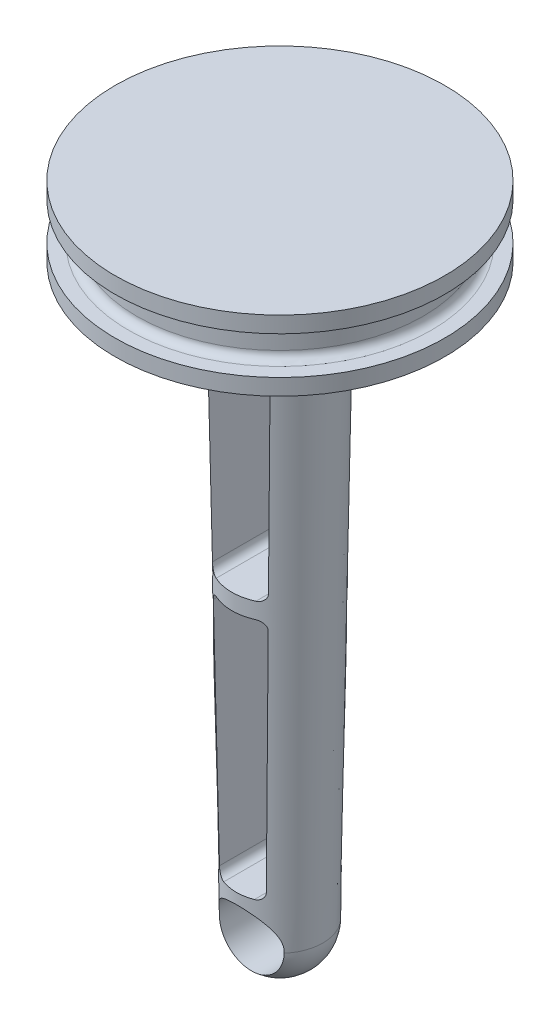
from build123d import *

# Parameters (mm, degrees)
CUT_EXTRUDE1_REACH                  = 68.589
CUT_EXTRUDE1_END_RADIUS             = 5
SKETCH2_R                           = 3
SKETCH2_W                           = 6
SKETCH2_H                           = 22.75
CUT_EXTRUDE1_DIRECTION_2_REACH      = 68.589
CUT_EXTRUDE1_DIRECTION_2_END_RADIUS = 5
CUT_EXTRUDE2_REACH                  = 70.089
CUT_EXTRUDE2_START                  = 1.5
SKETCH3_R                           = 12
SKETCH3_R_2                         = 5
DRAFT5_ANGLE                        = -1
FILLET3_R                           = 0.75
FILLET5_R                           = 3.964
FILLET6_R                           = 2.25


# Read off the part's stored shape, not the designer's step: Draft4
with BuildPart() as part:
    # Sketch1 → Revolve4 (revolve)
    with BuildSketch(Plane.XY, mode=Mode.PRIVATE) as revolve4_sk:
        Polygon((0, 8), (0, 0), (5, 0), (5, 56.5), (15.25, 56.5), (15.25, 58), (13.25, 58), (13.25, 61.5), (15.25, 61.5), (15.25, 63), (0, 63), (0, 61.5), align=None)
    revolve(revolve4_sk.sketch.rotate(Axis((0, 65.622230863, 0), (0, -1, 0)), 180), axis=Axis((0, 65.622230863, 0), (0, -1, 0)))

    # Cut-Extrude1: up to this cylinder (the profile starts inside it)
    cut_extrude1_end = Plane(origin=(0, 23.8125, 0), z_dir=(0, 1, 0)) * Cylinder(CUT_EXTRUDE1_END_RADIUS, 187.803, mode=Mode.PRIVATE)
    # Sketch2 → Cut-Extrude1 (cut, up to the surface)
    with BuildSketch(Plane.XY, mode=Mode.PRIVATE) as cut_extrude1_sk1:
        with Locations(Location((0, 4, 0), (0, 0, 180))):
            Circle(SKETCH2_R)
    cut_extrude1_tool1 = extrude(cut_extrude1_sk1.sketch, amount=-CUT_EXTRUDE1_REACH, mode=Mode.PRIVATE) & cut_extrude1_end
    add(cut_extrude1_tool1.solids().sort_by_distance((0, 4, 0))[0], mode=Mode.SUBTRACT)
    # Sketch2 → Cut-Extrude1 (cut, up to the surface)
    with BuildSketch(Plane.XY, mode=Mode.PRIVATE) as cut_extrude1_sk2:
        with Locations((0, 43.625)):
            Rectangle(SKETCH2_W, SKETCH2_H)
    cut_extrude1_tool2 = extrude(cut_extrude1_sk2.sketch, amount=-CUT_EXTRUDE1_REACH, mode=Mode.PRIVATE) & cut_extrude1_end
    add(cut_extrude1_tool2.solids().sort_by_distance((0, 43.625, 0))[0], mode=Mode.SUBTRACT)
    # Sketch2 → Cut-Extrude1 (cut, up to the surface)
    with BuildSketch(Plane.XY, mode=Mode.PRIVATE) as cut_extrude1_sk3:
        with Locations((0, 19.375)):
            Rectangle(SKETCH2_W, SKETCH2_H)
    cut_extrude1_tool3 = extrude(cut_extrude1_sk3.sketch, amount=-CUT_EXTRUDE1_REACH, mode=Mode.PRIVATE) & cut_extrude1_end
    add(cut_extrude1_tool3.solids().sort_by_distance((0, 19.375, 0))[0], mode=Mode.SUBTRACT)

    # Cut-Extrude1 direction 2: up to this cylinder (the profile starts inside it)
    cut_extrude1_direction_2_end = Plane(origin=(0, 23.8125, 0), z_dir=(0, 1, 0)) * Cylinder(CUT_EXTRUDE1_DIRECTION_2_END_RADIUS, 187.803, mode=Mode.PRIVATE)
    # Sketch2 → Cut-Extrude1 direction 2 (cut, up to the surface)
    with BuildSketch(Plane.XY, mode=Mode.PRIVATE) as cut_extrude1_direction_2_sk1:
        with Locations(Location((0, 4, 0), (0, 0, 180))):
            Circle(SKETCH2_R)
    cut_extrude1_direction_2_tool1 = extrude(cut_extrude1_direction_2_sk1.sketch, amount=CUT_EXTRUDE1_DIRECTION_2_REACH, mode=Mode.PRIVATE) & cut_extrude1_direction_2_end
    add(cut_extrude1_direction_2_tool1.solids().sort_by_distance((0, 4, 0))[0], mode=Mode.SUBTRACT)
    # Sketch2 → Cut-Extrude1 direction 2 (cut, up to the surface)
    with BuildSketch(Plane.XY, mode=Mode.PRIVATE) as cut_extrude1_direction_2_sk2:
        with Locations((0, 43.625)):
            Rectangle(SKETCH2_W, SKETCH2_H)
    cut_extrude1_direction_2_tool2 = extrude(cut_extrude1_direction_2_sk2.sketch, amount=CUT_EXTRUDE1_DIRECTION_2_REACH, mode=Mode.PRIVATE) & cut_extrude1_direction_2_end
    add(cut_extrude1_direction_2_tool2.solids().sort_by_distance((0, 43.625, 0))[0], mode=Mode.SUBTRACT)
    # Sketch2 → Cut-Extrude1 direction 2 (cut, up to the surface)
    with BuildSketch(Plane.XY, mode=Mode.PRIVATE) as cut_extrude1_direction_2_sk3:
        with Locations((0, 19.375)):
            Rectangle(SKETCH2_W, SKETCH2_H)
    cut_extrude1_direction_2_tool3 = extrude(cut_extrude1_direction_2_sk3.sketch, amount=CUT_EXTRUDE1_DIRECTION_2_REACH, mode=Mode.PRIVATE) & cut_extrude1_direction_2_end
    add(cut_extrude1_direction_2_tool3.solids().sort_by_distance((0, 19.375, 0))[0], mode=Mode.SUBTRACT)

    # Sketch3 → Cut-Extrude2 (cut, up to next)
    with BuildSketch(Plane.XZ.offset(-63).offset(CUT_EXTRUDE2_START), mode=Mode.PRIVATE) as cut_extrude2_sk1:
        Circle(SKETCH3_R)
        with Locations(Location((0, 0, 0), (0, 0, 180))):
            Circle(SKETCH3_R_2, mode=Mode.SUBTRACT)
    cut_extrude2_tool1 = extrude(cut_extrude2_sk1.sketch, amount=CUT_EXTRUDE2_REACH, mode=Mode.PRIVATE) & part.part
    add(cut_extrude2_tool1.solids().sort_by_distance((-11.660589, 61.5, 0))[0], mode=Mode.SUBTRACT)

    # Draft4 outline → Draft4 (revolve, cut)
    with BuildSketch(Plane.XY):
        Polygon((4.973817403, 61.5), (3.90033091, 0), (5, 0), (5, 61.5), align=None)
    revolve(axis=Axis((0, 0, 0), (0, 1, 0)), mode=Mode.SUBTRACT)

    # Draft5
    draft5_faces = [part.faces().sort_by_distance(p)[0] for p in [
        (3, 19.731668668, 0),
        (-3, 19.731668672, 0),
        (3, 43.90092481, 0),
        (-3, 43.900924809, 0),
    ]]
    draft(draft5_faces, Plane(origin=(0, 56.5, 0), x_dir=(-1, 0, 0), z_dir=(0, -1, 0)), DRAFT5_ANGLE)

    # Fillet3
    fillet3_edges = [part.edges().sort_by_distance(p)[0] for p in [
        (13.25, 61.5, 0),
        (13.25, 58, 0),
        (2.576714675, 32.25, 0),
        (-2.576714675, 32.25, 0),
        (-2.973817403, 55, 0),
        (2.973817403, 55, 0),
        (2.550532078, 30.75, 0),
        (-2.550532078, 30.75, 0),
        (2.153429351, 8, 0),
        (-2.153429351, 8, 0),
        (-4.973817403, 61.5, 0),
        (-12, 61.5, 0),
    ]]
    fillet(fillet3_edges, radius=FILLET3_R)

    # Fillet5
    # the kernel refuses this fillet: 3.964 mm, written as the material it takes off along each edge
    with BuildSketch(Plane(origin=(0, 0, 0), x_dir=(1, 0, 0), z_dir=(0, 0, 1))) as fillet5_piece_1:
        with BuildLine():
            CenterArc((3.90033091 - FILLET5_R * 0.982697263117, FILLET5_R), FILLET5_R, 270, 89)
            Line((3.90033091 - FILLET5_R * 0.982697263117, 0), (3.90033091, 0))
            Line((3.90033091, 0), (3.90033091 + FILLET5_R * 0.0171504320394, FILLET5_R * 0.982547593564))
        make_face()
    revolve(axis=Axis((0, 0, 0), (0, 1, 0)), mode=Mode.SUBTRACT)

    # Fillet6
    fillet6_edges = [part.edges().sort_by_distance(p)[0] for p in [
        (-12, 56.5, 0),
    ]]
    fillet(fillet6_edges, radius=FILLET6_R)


solid = part.part
